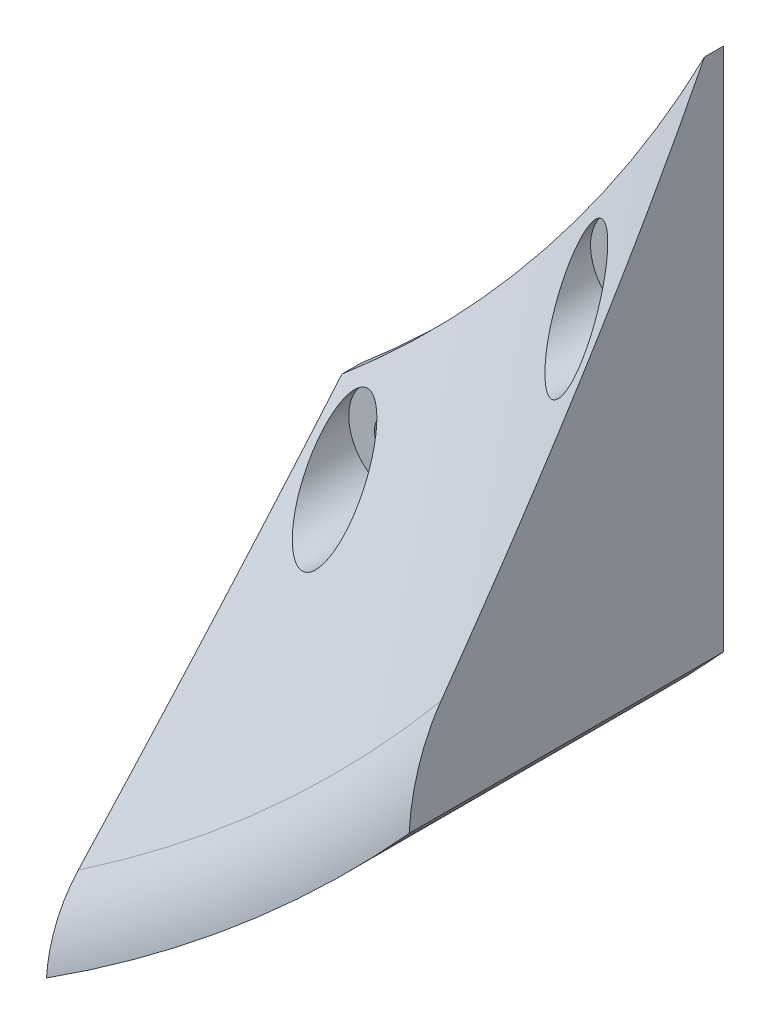
from build123d import *

# Parameters (mm, degrees)
SKETCH1_R               = 2.38125
BOSS_EXTRUDE1_DEPTH     = 3.175
BOSS_EXTRUDE2_DEPTH     = 50.8
CUT_EXTRUDE1_DEPTH      = 209.526843613
CUT_EXTRUDE1_DEPTH_BACK = 209.526843613
SKETCH3_R               = 203.829254644
SKETCH3_R_2             = 174.625
SKETCH5_R               = 2.38125
CUT_EXTRUDE3_DEPTH      = 200.484174202
SKETCH6_W               = 205.731089426
SKETCH6_H               = 25.4
BOSS_EXTRUDE3_DEPTH     = 3.175
SKETCH8_R               = 2.38125
CUT_EXTRUDE5_DEPTH      = 200.484174202
SKETCH9_W               = 205.731089426
SKETCH9_H               = 38.1
BOSS_EXTRUDE4_DEPTH     = 3.175
SKETCH10_R              = 6.35
SKETCH10_R_2            = 2.38125
CUT_EXTRUDE6_DEPTH      = 200.484174202
SKETCH11_W              = 53.331089426
SKETCH11_H              = 31.75
BOSS_EXTRUDE5_DEPTH     = 3.175
FILLET1_R               = 10.16
SKETCH12_R              = 6.35
SKETCH12_R_2            = 2.38125
CUT_EXTRUDE7_DEPTH      = 200.484174202
FILLET2_R               = 2.54
CUT_EXTRUDE8_DEPTH      = 200.484174202
SKETCH14_W              = 2.759281453
SKETCH14_H              = 7.963584416
SKETCH14_W_2            = 2.527010149
SKETCH14_H_2            = 5.938870156
BOSS_EXTRUDE6_DEPTH     = 3.175
FILLET3_R               = 2.54
SKETCH15_R              = 2.38125
BOSS_EXTRUDE7_DEPTH     = 33.02
SKETCH16_R              = 227.754671792
SKETCH16_W              = 368.539826918
SKETCH16_H              = 147.114866813
CUT_EXTRUDE9_DEPTH      = 217.033643064
SKETCH17_R              = 87.195519402
CUT_EXTRUDE10_DEPTH     = 217.033642998
CHAMFER1_SIZE           = 27.94
CHAMFER1_SIZE_2         = 31.030513664
CUT_EXTRUDE12_START     = -2.54
SKETCH18_R              = 5.08
CUT_EXTRUDE12_DEPTH     = 33.02
FILLET4_R               = 10.16
CUT_EXTRUDE13_START     = -38.099995
SKETCH19_R              = 70.994778985
CUT_EXTRUDE13_DEPTH     = 144.077950099


with BuildPart() as part:
    # Sketch1 → Boss-Extrude1 (new body)
    with BuildSketch(Plane.XY):
        with BuildLine():
            Line((-102.865544713, 31.75), (-102.865544713, 145.022480019))
            ThreePointArc((-102.865544713, 145.022480019), (-123.286100955, 128.114703728), (-140.965544713, 108.358457002))
            Line((-140.965544713, 108.358457002), (-140.965544713, -108.358457002))
            ThreePointArc((-140.965544713, -108.358457002), (-123.286100955, -128.114703728), (-102.865544713, -145.022480019))
            Line((-102.865544713, -145.022480019), (-102.865544713, -69.85))
            Line((-102.865544713, -69.85), (102.865544713, -69.85))
            Line((102.865544713, -69.85), (102.865544713, -145.022480019))
            ThreePointArc((102.865544713, -145.022480019), (123.286100955, -128.114703728), (140.965544713, -108.358457002))
            Line((140.965544713, -108.358457002), (140.965544713, 108.358457002))
            ThreePointArc((140.965544713, 108.358457002), (123.286100955, 128.114703728), (102.865544713, 145.022480019))
            Line((102.865544713, 145.022480019), (102.865544713, 31.75))
            Line((102.865544713, 31.75), (-102.865544713, 31.75))
        make_face()
        with Locations((25.4, -38.1)):
            Circle(SKETCH1_R, mode=Mode.SUBTRACT)
        with Locations((-25.4, -38.1)):
            Circle(SKETCH1_R, mode=Mode.SUBTRACT)
        with Locations((0, -38.1)):
            Circle(SKETCH1_R, mode=Mode.SUBTRACT)
    extrude(amount=BOSS_EXTRUDE1_DEPTH)

    # Sketch2 → Boss-Extrude2 (add)
    with BuildSketch(Plane.XY.offset(3.175)):
        with BuildLine():
            ThreePointArc((-102.865544713, -141.111907137), (-123.390730203, -123.566250752), (-140.965544713, -103.06602655))
            Line((-140.965544713, -103.06602655), (-140.965544713, -108.358457002))
            ThreePointArc((-140.965544713, -108.358457002), (-123.286100955, -128.114703728), (-102.865544713, -145.022480019))
            Line((-102.865544713, -145.022480019), (-102.865544713, -141.111907137))
        make_face()
        with BuildLine():
            ThreePointArc((140.965544713, -103.06602655), (123.390730203, -123.566250752), (102.865544713, -141.111907137))
            Line((102.865544713, -141.111907137), (102.865544713, -145.022480019))
            ThreePointArc((102.865544713, -145.022480019), (123.286100955, -128.114703728), (140.965544713, -108.358457002))
            Line((140.965544713, -108.358457002), (140.965544713, -103.06602655))
        make_face()
    extrude(amount=BOSS_EXTRUDE2_DEPTH)

    # Sketch3 → Cut-Extrude1 (cut, two sides: drawn at the far end of the back side and taken through both)
    with BuildSketch(Plane.XY.offset(3.175).offset(-CUT_EXTRUDE1_DEPTH_BACK)):
        Circle(SKETCH3_R)
        Circle(SKETCH3_R_2, mode=Mode.SUBTRACT)
    extrude(amount=CUT_EXTRUDE1_DEPTH + CUT_EXTRUDE1_DEPTH_BACK, mode=Mode.SUBTRACT)

    # Sketch5 → Cut-Extrude3 (cut, through all)
    with BuildSketch(Plane.XY.offset(3.175)):
        with Locations((134.615544713, -95.585904409)):
            Circle(SKETCH5_R)
        with Locations((109.215544713, -123.814275401)):
            Circle(SKETCH5_R)
        with Locations(Location((-134.615544713, -95.585904409, 0), (0, 0, 180))):
            Circle(SKETCH5_R)
        with Locations(Location((-109.215544713, -123.814275401, 0), (0, 0, 180))):
            Circle(SKETCH5_R)
    extrude(amount=-CUT_EXTRUDE3_DEPTH, mode=Mode.SUBTRACT)

    # Sketch6 → Boss-Extrude3 (add)
    with BuildSketch(Plane.XY.offset(3.175)):
        with Locations((0, 77.611907137)):
            Rectangle(SKETCH6_W, SKETCH6_H)
    extrude(amount=-BOSS_EXTRUDE3_DEPTH)

    # Sketch8 → Cut-Extrude5 (cut, through all)
    with BuildSketch(Plane.XY.offset(3.175)):
        with Locations((-38.1, -38.1)):
            Circle(SKETCH8_R)
        with Locations((-50.8, -38.1)):
            Circle(SKETCH8_R)
        with Locations((12.7, -38.1)):
            Circle(SKETCH8_R)
        with Locations((-12.7, -38.1)):
            Circle(SKETCH8_R)
    extrude(amount=-CUT_EXTRUDE5_DEPTH, mode=Mode.SUBTRACT)

    # Sketch9 → Boss-Extrude4 (add)
    with BuildSketch(Plane.XY.offset(3.175)):
        with Locations((0, -88.9)):
            Rectangle(SKETCH9_W, SKETCH9_H)
    extrude(amount=-BOSS_EXTRUDE4_DEPTH)

    # Sketch10 → Cut-Extrude6 (cut, through all)
    with BuildSketch(Plane.XY.offset(3.175)):
        with Locations((0, -76.2)):
            Circle(SKETCH10_R)
        with Locations((-25.4, -76.2)):
            Circle(SKETCH10_R_2)
        with Locations((-38.1, -76.2)):
            Circle(SKETCH10_R_2)
        with Locations((25.4, -76.2)):
            Circle(SKETCH10_R_2)
    extrude(amount=-CUT_EXTRUDE6_DEPTH, mode=Mode.SUBTRACT)

    # Sketch11 → Boss-Extrude5 (add)
    with BuildSketch(Plane.XY.offset(3.175)):
        with Locations((0, -123.825)):
            Rectangle(SKETCH11_W, SKETCH11_H)
    extrude(amount=-BOSS_EXTRUDE5_DEPTH)

    # Fillet1
    fillet1_edges = [part.edges().sort_by_distance(p)[0] for p in [
        (-26.665544713, -139.7, 1.5875),
        (-26.665544713, -107.95, 1.5875),
        (26.665544713, -107.95, 1.5875),
        (26.665544713, -139.7, 1.5875),
    ]]
    fillet(fillet1_edges, radius=FILLET1_R)

    # Sketch12 → Cut-Extrude7 (cut, through all)
    with BuildSketch(Plane.XY.offset(3.175)):
        with Locations((-25.4, -76.2)):
            Circle(SKETCH12_R)
        with Locations((25.4, -76.2)):
            Circle(SKETCH12_R)
        with Locations((-8.66775, -67.53225)):
            Circle(SKETCH12_R_2)
        with Locations((8.66775, -67.53225)):
            Circle(SKETCH12_R_2)
        with Locations((8.66775, -84.86775)):
            Circle(SKETCH12_R_2)
        with Locations((-8.66775, -84.86775)):
            Circle(SKETCH12_R_2)
    extrude(amount=-CUT_EXTRUDE7_DEPTH, mode=Mode.SUBTRACT)

    # Fillet2
    fillet2_edges = [part.edges().sort_by_distance(p)[0] for p in [
        (-102.865544713, 141.111907137, 1.5875),
        (102.865544713, 141.111907137, 1.5875),
    ]]
    fillet(fillet2_edges, radius=FILLET2_R)

    # Sketch13 → Cut-Extrude8 (cut, through all)
    # profile 1 of 4: a face of its own
    with BuildSketch(Plane.XY.offset(3.175)):
        with BuildLine():
            Line((-29.807958333, -15.810565048), (-38.216416667, -15.810565048))
            Line((-38.216416667, -15.810565048), (-33.538583333, 6.245101619))
            Line((-33.538583333, 6.245101619), (-38.803791667, 6.245101619))
            Line((-38.803791667, 6.245101619), (-39.682208333, 2.075268285))
            Line((-39.682208333, 2.075268285), (-48.095958333, 2.075268285))
            Line((-48.095958333, 2.075268285), (-47.397458333, 5.477809952))
            add(Edge.make_bspline(
                [(-47.397458333, 5.477809952), (-47.320569058, 5.758194134), (-47.170922216, 6.303895823), (-46.789013651, 7.053374007), (-46.29771223, 7.715065901), (-45.690436731, 8.272796577), (-45.006500067, 8.730292102), (-44.253147871, 9.054960677), (-43.448405111, 9.260244914), (-42.891974442, 9.282012228), (-42.6085, 9.293101619)],
                knots=[0, 0, 0, 0, 1.050168006, 2.043904372, 3.024673376, 4.01863537, 5.013909092, 5.989008141, 6.975497172, 8, 8, 8, 8], degree=3))
            Line((-42.6085, 9.293101619), (-24.463375, 9.293101619))
            Line((-24.463375, 9.293101619), (-29.807958333, -15.810565048))
        make_face()
    # profile 2 of 4: a face of its own
    with BuildSketch(Plane.XY.offset(3.175)):
        with BuildLine():
            add(Edge.make_bspline(
                [(-3.566583333, -12.132856715), (-3.643765668, -12.421811436), (-3.79437451, -12.985659844), (-4.17293599, -13.764550451), (-4.665381385, -14.453577746), (-5.270434906, -15.036263062), (-5.950809803, -15.518035961), (-6.703009887, -15.859816489), (-7.511777843, -16.068702787), (-8.070292693, -16.093985699), (-8.355541667, -16.106898381)],
                knots=[0, 0, 0, 0, 1.062369753, 2.073042759, 3.062499936, 4.061251344, 5.048575831, 6.014824268, 6.986115874, 8, 8, 8, 8], degree=3))
            Line((-8.355541667, -16.106898381), (-22.547791667, -16.106898381))
            add(Edge.make_bspline(
                [(-22.547791667, -16.106898381), (-22.69262218, -16.104596964), (-22.972752339, -16.100145578), (-23.378206431, -16.044702396), (-23.755568174, -15.960682303), (-24.107157142, -15.846746121), (-24.426210233, -15.691540895), (-24.716954418, -15.504453058), (-24.976786635, -15.281711317), (-25.203806964, -15.025677099), (-25.40308213, -14.746169713), (-25.554358436, -14.435544628), (-25.674211179, -14.106195373), (-25.74344938, -13.752832717), (-25.791514529, -13.37950469), (-25.77975916, -12.981941289), (-25.73922686, -12.562383844), (-25.682974686, -12.278883611), (-25.654, -12.132856715)],
                knots=[0, 0, 0, 0, 1.158779845, 2.241303809, 3.269110906, 4.251580925, 5.192683609, 6.101443689, 7.012833415, 7.922909267, 8.835720222, 9.751475912, 10.680528402, 11.633319635, 12.628295421, 13.687540584, 14.808885378, 16, 16, 16, 16], degree=3))
            Line((-25.654, -12.132856715), (-21.997458333, 5.319059952))
            add(Edge.make_bspline(
                [(-21.997458333, 5.319059952), (-21.920272116, 5.608009048), (-21.769655695, 6.171846477), (-21.391148554, 6.950815808), (-20.898502375, 7.639552216), (-20.293153244, 8.224337096), (-19.608609326, 8.702683082), (-18.855913228, 9.046275843), (-18.048644228, 9.254382857), (-17.4919553, 9.28003834), (-17.2085, 9.293101619)],
                knots=[0, 0, 0, 0, 1.062516124, 2.073328378, 3.062921881, 4.061810895, 5.05442655, 6.020808115, 6.992233544, 8, 8, 8, 8], degree=3))
            Line((-17.2085, 9.293101619), (-3.01625, 9.293101619))
            add(Edge.make_bspline(
                [(-3.01625, 9.293101619), (-2.871419505, 9.290800192), (-2.591289383, 9.286348788), (-2.185835038, 9.230905733), (-1.808474182, 9.146885197), (-1.456882118, 9.03295056), (-1.137839887, 8.877739913), (-0.847056821, 8.690671483), (-0.587369032, 8.467857656), (-0.359809395, 8.212092615), (-0.16209325, 7.930921186), (-0.002983257, 7.623293687), (0.114459046, 7.2921344), (0.187047795, 6.939473562), (0.223589985, 6.565305639), (0.223678302, 6.168188246), (0.179743785, 5.748571863), (0.123975462, 5.465081675), (0.09525, 5.319059952)],
                knots=[0, 0, 0, 0, 1.158432062, 2.24063113, 3.268129752, 4.250304904, 5.191125136, 6.099612471, 7.010728663, 7.920531375, 8.833068369, 9.75494936, 10.683723015, 11.636228288, 12.62940148, 13.688234619, 14.809242866, 16, 16, 16, 16], degree=3))
            Line((0.09525, 5.319059952), (-3.566583333, -12.132856715))
        make_face()
        Polygon((-13.403791667, 6.245101619), (-17.425458333, -13.058898381), (-12.16025, -13.058898381), (-8.138583333, 6.245101619), align=None, mode=Mode.SUBTRACT)
    # profile 3 of 4: a face of its own
    with BuildSketch(Plane.XY.offset(3.175)):
        with BuildLine():
            Line((11.557, 9.293101619), (8.556625, -5.269565048))
            Line((8.556625, -5.269565048), (13.827125, -5.269565048))
            Line((13.827125, -5.269565048), (16.8275, 9.293101619))
            Line((16.8275, 9.293101619), (25.235958333, 9.293101619))
            Line((25.235958333, 9.293101619), (19.896666667, -16.106898381))
            Line((19.896666667, -16.106898381), (11.482916667, -16.106898381))
            Line((11.482916667, -16.106898381), (13.165666667, -8.317565048))
            Line((13.165666667, -8.317565048), (3.439583333, -8.317565048))
            add(Edge.make_bspline(
                [(3.439583333, -8.317565048), (3.294736233, -8.315312365), (3.014573993, -8.310955241), (2.609344629, -8.25485176), (2.230636814, -8.173029355), (1.881290806, -8.050712181), (1.561052368, -7.897312045), (1.270346477, -7.709804396), (1.009103929, -7.48515858), (0.777806767, -7.227358437), (0.580756638, -6.941550122), (0.426179112, -6.6292081), (0.309007624, -6.297036788), (0.237889907, -5.94070984), (0.190785312, -5.563660832), (0.202000265, -5.162620664), (0.243321079, -4.739613917), (0.29915982, -4.45427987), (0.328083333, -4.306481715)],
                knots=[0, 0, 0, 0, 1.152191709, 2.228561082, 3.250524676, 4.231939746, 5.167691878, 6.071285285, 6.977493388, 7.902223819, 8.821393841, 9.731943086, 10.66895861, 11.616332835, 12.619603957, 13.686867372, 14.801836863, 16, 16, 16, 16], degree=3))
            Line((0.328083333, -4.306481715), (3.14325, 9.293101619))
            Line((3.14325, 9.293101619), (11.557, 9.293101619))
        make_face()
    # profile 4 of 4: a face of its own
    with BuildSketch(Plane.XY.offset(3.175)):
        with BuildLine():
            Line((33.374541667, -13.058898381), (47.0535, -13.058898381))
            Line((47.0535, -13.058898381), (46.392041667, -16.106898381))
            Line((46.392041667, -16.106898381), (24.304625, -16.106898381))
            Line((24.304625, -16.106898381), (25.802166667, -9.143065048))
            add(Edge.make_bspline(
                [(25.802166667, -9.143065048), (25.879273752, -8.861031474), (26.029757165, -8.310610268), (26.410334887, -7.552072135), (26.901419327, -6.879703753), (27.508831265, -6.311820899), (28.191228528, -5.842472815), (28.946271137, -5.513745702), (29.752164487, -5.300517366), (30.311046908, -5.28002739), (30.596416667, -5.269565048)],
                knots=[0, 0, 0, 0, 1.049169808, 2.047576474, 3.031944376, 4.027910562, 5.023553593, 5.994653504, 6.976054309, 8, 8, 8, 8], degree=3))
            Line((30.596416667, -5.269565048), (40.3225, -5.269565048))
            Line((40.3225, -5.269565048), (42.661416667, 6.245101619))
            Line((42.661416667, 6.245101619), (37.396208333, 6.245101619))
            Line((37.396208333, 6.245101619), (36.517791667, 2.075268285))
            Line((36.517791667, 2.075268285), (28.104041667, 2.075268285))
            Line((28.104041667, 2.075268285), (28.802541667, 5.477809952))
            add(Edge.make_bspline(
                [(28.802541667, 5.477809952), (28.879430942, 5.758194134), (29.029077784, 6.303895823), (29.410986349, 7.053374007), (29.90228777, 7.715065901), (30.509563269, 8.272796577), (31.193499933, 8.730292102), (31.946852129, 9.054960677), (32.751594889, 9.260244914), (33.308025558, 9.282012228), (33.5915, 9.293101619)],
                knots=[0, 0, 0, 0, 1.050168006, 2.043904372, 3.024673376, 4.01863537, 5.013909092, 5.989008141, 6.975497172, 8, 8, 8, 8], degree=3))
            Line((33.5915, 9.293101619), (47.78375, 9.293101619))
            add(Edge.make_bspline(
                [(47.78375, 9.293101619), (47.92859726, 9.290849086), (48.208759811, 9.286492252), (48.613987002, 9.230386738), (48.992702458, 9.148571481), (49.342021711, 9.026229282), (49.662353678, 8.87291663), (49.952725098, 8.685096123), (50.214324347, 8.462382804), (50.440285412, 8.20121114), (50.636405741, 7.915869715), (50.798510828, 7.606235104), (50.913345969, 7.272328086), (50.987754572, 6.916671215), (51.023365934, 6.538801464), (51.023963511, 6.138199286), (50.97928388, 5.715135649), (50.923924969, 5.429811378), (50.89525, 5.282018285)],
                knots=[0, 0, 0, 0, 1.152517565, 2.229191352, 3.251443972, 4.233136601, 5.169153376, 6.073002333, 6.979466726, 7.895134038, 8.814564014, 9.731738245, 10.66901877, 11.616660927, 12.618740334, 13.686213184, 14.801498005, 16, 16, 16, 16], degree=3))
            Line((50.89525, 5.282018285), (48.916166667, -4.306481715))
            add(Edge.make_bspline(
                [(48.916166667, -4.306481715), (48.838706266, -4.597052385), (48.687148602, -5.165577869), (48.311448965, -5.952788492), (47.817473721, -6.648200027), (47.212376239, -7.235653604), (46.533647997, -7.724482215), (45.778706123, -8.063324207), (44.971906745, -8.281163221), (44.41262475, -8.30526518), (44.127208333, -8.317565048)],
                knots=[0, 0, 0, 0, 1.06412456, 2.082047477, 3.072647496, 4.071792832, 5.058775816, 6.021176094, 6.990153746, 8, 8, 8, 8], degree=3))
            Line((44.127208333, -8.317565048), (34.395833333, -8.317565048))
            Line((34.395833333, -8.317565048), (33.374541667, -13.058898381))
        make_face()
    extrude(amount=-CUT_EXTRUDE8_DEPTH, mode=Mode.SUBTRACT)


with BuildPart() as cut_extrude8_piece_1:
    # of the separate pieces the step leaves, piece 1, a body of its own (cut_extrude8_pieces)
    add(part.part.solids().sort_by_distance((-106.961346111, 138.033188267, 0))[0])



with BuildPart() as cut_extrude8_piece_2:
    # of the separate pieces the step leaves, piece 2, a body of its own (cut_extrude8_pieces)
    add(part.part.solids().sort_by_distance((-8.138583333, 6.245101619, 0))[0])


with BuildPart() as cut_extrude8_piece_1_1:
    add(cut_extrude8_piece_1.part)

    add(cut_extrude8_piece_2.part)  # Boss-Extrude6 merges Cut-Extrude8 piece 2
    # Sketch14 → Boss-Extrude6 (add)
    with BuildSketch(Plane.XY.offset(3.175)):
        with Locations((-11.017521916, 7.88967512)):
            Rectangle(SKETCH14_W, SKETCH14_H)
        with Locations((-14.795211944, -14.779945163)):
            Rectangle(SKETCH14_W_2, SKETCH14_H_2)
    extrude(amount=-BOSS_EXTRUDE6_DEPTH)

    # Fillet3
    fillet3_edges = [cut_extrude8_piece_1_1.edges().sort_by_distance(p)[0] for p in [
        (102.865544713, 90.311907137, 1.5875),
        (102.865544713, 31.75, 1.5875),
        (-102.865544713, 64.911907137, 1.5875),
        (-102.865544713, 31.75, 1.5875),
        (-102.865544713, 90.311907137, 1.5875),
        (102.865544713, 64.911907137, 1.5875),
    ]]
    fillet(fillet3_edges, radius=FILLET3_R)

    # Sketch15 → Boss-Extrude7 (add)
    # profile 1 of 2: a face of its own
    with BuildSketch(Plane.XY.offset(3.175)):
        with BuildLine():
            ThreePointArc((-102.865544713, -120.914193587), (-124.246259111, -98.815128381), (-140.965544713, -73.008750871))
            Line((-140.965544713, -73.008750871), (-140.965544713, -128.136510034))
            ThreePointArc((-140.965544713, -128.136510034), (-122.97425317, -145.49083496), (-102.865544713, -160.340044003))
            Line((-102.865544713, -160.340044003), (-102.865544713, -120.914193587))
        make_face()
        with Locations((-109.215544713, -123.814275401)):
            Circle(SKETCH15_R, mode=Mode.SUBTRACT)
        with Locations((-134.615544713, -95.585904409)):
            Circle(SKETCH15_R, mode=Mode.SUBTRACT)
    # profile 2 of 2: a face of its own
    with BuildSketch(Plane.XY.offset(3.175)):
        with BuildLine():
            Line((140.965544713, -128.136510034), (140.965544713, -73.008750871))
            ThreePointArc((140.965544713, -73.008750871), (124.246259111, -98.815128381), (102.865544713, -120.914193587))
            Line((102.865544713, -120.914193587), (102.865544713, -160.340044003))
            ThreePointArc((102.865544713, -160.340044003), (122.97425317, -145.49083496), (140.965544713, -128.136510034))
        make_face()
        with Locations((109.215544713, -123.814275401)):
            Circle(SKETCH15_R, mode=Mode.SUBTRACT)
        with Locations((134.615544713, -95.585904409)):
            Circle(SKETCH15_R, mode=Mode.SUBTRACT)
    extrude(amount=BOSS_EXTRUDE7_DEPTH)

    # Sketch16 → Cut-Extrude9 (cut, through all)
    with BuildSketch(Plane.XY.offset(3.175)):
        Circle(SKETCH16_R)
        with Locations((23.411183864, 115.93750226)):
            Rectangle(SKETCH16_W, SKETCH16_H)
    extrude(amount=-CUT_EXTRUDE9_DEPTH, mode=Mode.SUBTRACT)


with BuildPart() as cut_extrude9_piece_1:
    # of the separate pieces the step leaves, piece 1, a body of its own (cut_extrude9_pieces)
    add(cut_extrude8_piece_1_1.part.solids().sort_by_distance((-140.965544713, -128.136510034, 3.175))[0])

    # Chamfer1
    # the kernel refuses this chamfer: 31.030513664, 27.94 mm, written as the material it takes off along each edge
    with BuildSketch(Plane(origin=(0, 0, 36.195), x_dir=(-0.20017923188636447, -0.9797592944807337, 0), z_dir=(0.9797592944807337, -0.20017923188636447, 0))) as chamfer1_piece_1:
        Polygon((158.75 + CHAMFER1_SIZE, 0), (158.75, CHAMFER1_SIZE_2), (158.75, 0), align=None)
    revolve(axis=Axis((0, 0, 36.195), (0, 0, -1)), revolution_arc=79.913485183, mode=Mode.SUBTRACT)

    # Sketch18 → Cut-Extrude12 (cut)
    with BuildSketch(Plane(origin=(0, 0, 3.175), x_dir=(-1, 0, 0), z_dir=(0, 0, -1)).offset(CUT_EXTRUDE12_START)):
        with Locations((134.615544713, -95.585904409)):
            Circle(SKETCH18_R)
        with Locations((109.215544713, -123.814275401)):
            Circle(SKETCH18_R)
    extrude(amount=-CUT_EXTRUDE12_DEPTH, mode=Mode.SUBTRACT)

    # Fillet4
    # the kernel refuses this fillet: 10.16 mm, written as the material it takes off along each edge
    with BuildSketch(Plane(origin=(0, 0, 36.195), x_dir=(-0.4998842027499923, -0.8660922490364434, 0), z_dir=(0.8660922490364434, -0.4998842027499923, 0))) as fillet4_piece_1:
        with BuildLine():
            CenterArc((191.237667396, 10.133185423), FILLET4_R, 222, 43.836372996)
            Line((183.68731597, 3.334818462), (183.536308941, 3.198851123))
            Line((183.536308941, 3.198851123), (186.538992971, -0.135967339))
            Line((186.538992971, -0.135967339), (186.69, -0.2032))
            ThreePointArc((186.69, -0.2032), (188.595, -0.2032), (190.485246652, -0.202663708))
            Line((190.485246652, -0.202663708), (190.5, 0))
        make_face()
    revolve(axis=Axis((0, 0, 36.195), (0, 0, -1)), revolution_arc=22.482929592, mode=Mode.SUBTRACT)

    # Mirror1: Cut-Extrude9 piece 1 across plane


with BuildPart() as cut_extrude9_piece_2:
    # of the separate pieces the step leaves, piece 2, a body of its own (cut_extrude9_pieces)
    add(cut_extrude8_piece_1_1.part.solids().sort_by_distance((140.965544713, -73.008750871, 3.175))[0])

    # Sketch17 → Cut-Extrude10 (cut, through all)
    with BuildSketch(Plane.XY.offset(36.195)):
        with Locations((124.015012721, -121.332950523)):
            Circle(SKETCH17_R)
    extrude(amount=-CUT_EXTRUDE10_DEPTH, mode=Mode.SUBTRACT)


with BuildPart() as cut_extrude9_piece_1_1:
    add(cut_extrude9_piece_1.part)
    add(cut_extrude9_piece_1.part.mirror(Plane(origin=(-102.865544713, 0, 3.175), x_dir=(0, 0, 1), z_dir=(1, 0, 0))))

    # Sketch19 → Cut-Extrude13 (cut, through all)
    with BuildSketch(Plane(origin=(-64.765544713, 0, 0), x_dir=(0, 0, -1), z_dir=(1, 0, 0)).offset(CUT_EXTRUDE13_START)):
        with Locations((-10.603538112, -117.940143587)):
            Circle(SKETCH19_R)
    extrude(amount=-CUT_EXTRUDE13_DEPTH, mode=Mode.SUBTRACT)


solid = cut_extrude9_piece_1_1.part
